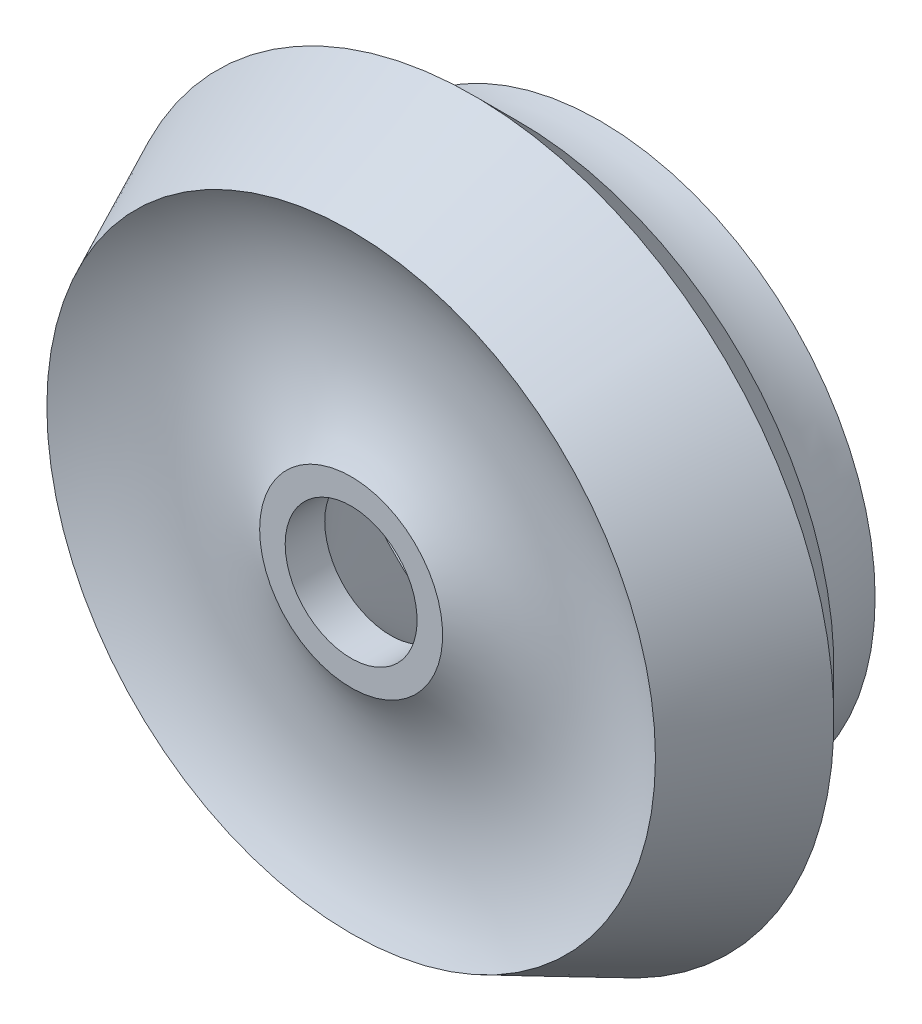
from build123d import *


with BuildPart() as part:
    # Hatch Sketch → Hatch Revolution (revolve)
    with BuildSketch(Plane(origin=(0, 0, 0), x_dir=(0, 0, -1), z_dir=(1, 0, 0))):
        with BuildLine():
            Line((587.274308735, 273.648124971), (495, 230.651707126))
            ThreePointArc((495, 230.651707126), (518.527464888, 150), (495, 69.348292874))
            Line((495, 69.348292874), (495, 50))
            Line((495, 50), (525, 50))
            Line((525, 50), (658.847763109, 183.847763109))
            ThreePointArc((658.847763109, 183.847763109), (671.744192687, 169.975653092), (683.59650045, 155.201481952))
            Line((683.59650045, 155.201481952), (683.59650045, 208.59650045))
            ThreePointArc((683.59650045, 208.59650045), (643.910388309, 209.909991295), (606.825613004, 224.102672354))
            Line((606.825613004, 224.102672354), (621.822687178, 239.099746528))
            Line((621.822687178, 239.099746528), (587.274308735, 273.648124971))
        make_face()
    revolve(axis=Axis((0, 0, -546.1), (0, 0, 1)))


solid = part.part
